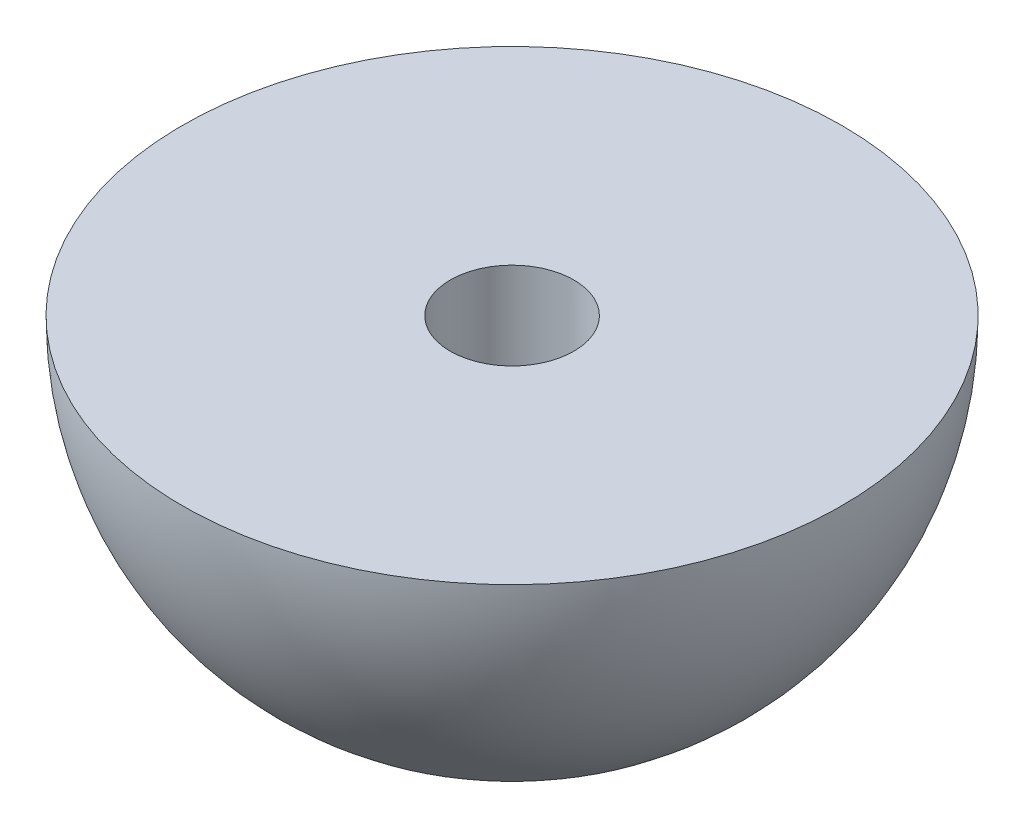
from build123d import *

# Parameters (mm, degrees)
SKETCH_2_R          = 1.5
CUT_EXTRUDE_1_DEPTH = 14.856406461


with BuildPart() as part:
    # ｽｹｯﾁ1 → 回転1 (revolve)
    with BuildSketch(Plane.XY):
        with BuildLine():
            Line((0, -8), (0, 0))
            Line((0, 0), (8, 0))
            ThreePointArc((8, 0), (5.656854249, -5.656854249), (0, -8))
        make_face()
    revolve(axis=Axis((0, -8, 0), (0, 1, 0)))

    # ｽｹｯﾁ2 → ｶｯﾄ - 押し出し1 (cut, through all)
    with BuildSketch(Plane(origin=(0, 0, 0), x_dir=(1, 0, 0), z_dir=(0, 1, 0))):
        Circle(SKETCH_2_R)
    extrude(amount=-CUT_EXTRUDE_1_DEPTH, mode=Mode.SUBTRACT)


solid = part.part
